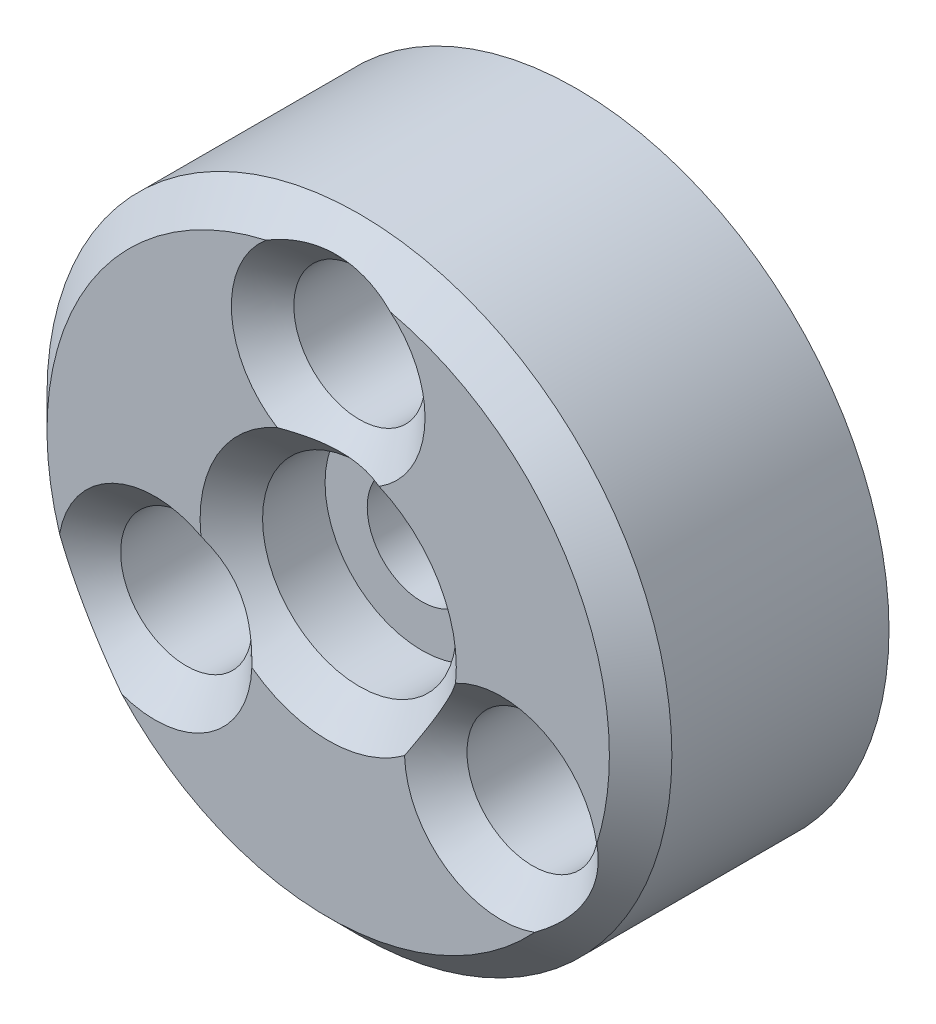
from build123d import *

# Parameters (mm, degrees)
SKETCH1_R                = 10
SKETCH1_R_2              = 2.1
SKETCH1_R_3              = 1.75
BOSS_EXTRUDE1_DEPTH      = 4
SKETCH2_R                = 9.05
CUT_EXTRUDE1_DEPTH       = 2.9
CHAMFER1_SIZE            = 1
BOSS_EXTRUDE2_DEPTH      = 2.9
BOSS_EXTRUDE2_DEPTH_BACK = 5.1
SKETCH3_R                = 2.1
CHAMFER2_SIZE            = 0.6
SKETCH4_R                = 3.1
CUT_EXTRUDE2_DEPTH       = 3
SKETCH5_R                = 2.1
CUT_EXTRUDE3_DEPTH       = 4
SKETCH6_R                = 0.625
CUT_EXTRUDE4_DEPTH       = 15.696938457
CIRPATTERN1_COUNT        = 3
CHAMFER3_SIZE            = 1
CHAMFER4_SIZE            = 1


with BuildPart() as part:
    # Sketch1 → Boss-Extrude1 (new, symmetric)
    with BuildSketch(Plane.XY):
        Circle(SKETCH1_R)
        with Locations((6, 0)):
            Circle(SKETCH1_R_2, mode=Mode.SUBTRACT)
        Circle(SKETCH1_R_3, mode=Mode.SUBTRACT)
        with Locations((0, -6)):
            Circle(SKETCH1_R_2, mode=Mode.SUBTRACT)
        with Locations((-6, 0)):
            Circle(SKETCH1_R_2, mode=Mode.SUBTRACT)
        with Locations((0, 6)):
            Circle(SKETCH1_R_2, mode=Mode.SUBTRACT)
    extrude(amount=BOSS_EXTRUDE1_DEPTH, both=True)

    # Sketch2 → Cut-Extrude1 (cut)
    with BuildSketch(Plane(origin=(0, 0, -4), x_dir=(-1, 0, 0), z_dir=(0, 0, -1))):
        Circle(SKETCH2_R)
    extrude(amount=-CUT_EXTRUDE1_DEPTH, mode=Mode.SUBTRACT)

    # Chamfer1
    # the kernel refuses this chamfer: 1 mm, written as the material it takes off along each edge
    with BuildSketch(Plane(origin=(0, 0, -4), x_dir=(-1, 0, 0), z_dir=(0, -1, 0))) as chamfer1_piece_1:
        Polygon((9.05 + CHAMFER1_SIZE, 0), (9.05, -CHAMFER1_SIZE), (9.05, 0), align=None)
    revolve(axis=Axis((0, 0, -4), (0, 0, -1)), mode=Mode.SUBTRACT)

    # Sketch3 → Boss-Extrude2 (add, two sides: drawn at the far end of the back side and taken through both)
    with BuildSketch(Plane(origin=(0, 0, -1.1), x_dir=(-1, 0, 0), z_dir=(0, 0, -1)).offset(-BOSS_EXTRUDE2_DEPTH_BACK)):
        with Locations((-6, 0)):
            Circle(SKETCH3_R)
        with Locations((0, -6)):
            Circle(SKETCH3_R)
        with Locations((6, 0)):
            Circle(SKETCH3_R)
        with Locations((0, 6)):
            Circle(SKETCH3_R)
    extrude(amount=BOSS_EXTRUDE2_DEPTH + BOSS_EXTRUDE2_DEPTH_BACK)

    # Chamfer2
    chamfer2_edges = [part.edges().sort_by_distance(p)[0] for p in [
        (8.1, 0, -4),
        (2.1, -6, -4),
        (-3.9, 0, -4),
        (2.1, 6, -4),
    ]]
    chamfer(chamfer2_edges, length=CHAMFER2_SIZE)

    # Sketch4 → Cut-Extrude2 (cut)
    with BuildSketch(Plane.XY.offset(4)):
        Circle(SKETCH4_R)
    extrude(amount=-CUT_EXTRUDE2_DEPTH, mode=Mode.SUBTRACT)

    # Sketch5 → Cut-Extrude3 (cut)
    with BuildSketch(Plane.XY.offset(4)):
        with Locations((0, 6.4)):
            Circle(SKETCH5_R)
        with Locations((5.542562584, -3.2)):
            Circle(SKETCH5_R)
        with Locations((-5.542562584, -3.2)):
            Circle(SKETCH5_R)
    extrude(amount=-CUT_EXTRUDE3_DEPTH, mode=Mode.SUBTRACT)

    # Sketch6 → Cut-Extrude4 (cut, through all)
    with BuildSketch(Plane.XY):
        with Locations((0, 6.4)):
            Circle(SKETCH6_R)
    cut_extrude4 = extrude(amount=-CUT_EXTRUDE4_DEPTH, mode=Mode.SUBTRACT)

    # CirPattern1: Cut-Extrude4 ×3 about axis
    cirpattern1_axis = Axis((0, 0, 0), (0, 0, 1))
    for i in range(1, CIRPATTERN1_COUNT):
        add(cut_extrude4.rotate(cirpattern1_axis, i * 360 / CIRPATTERN1_COUNT), mode=Mode.SUBTRACT)

    # Chamfer3
    chamfer3_edges = [part.edges().sort_by_distance(p)[0] for p in [
        (-0.625, 6.4, 0),
        (5.855062584, -2.658734123, 0),
        (-5.230062584, -3.741265877, 0),
    ]]
    chamfer(chamfer3_edges, length=CHAMFER3_SIZE)

    # Chamfer4
    # the kernel refuses this chamfer: 1 mm, written as the material it takes off along each edge
    with BuildSketch(Plane(origin=(0, 6.4, 4), x_dir=(1, 0, 0), z_dir=(0, -1, 0))) as chamfer4_piece_1:
        Polygon((2.1 + CHAMFER4_SIZE, 0), (2.1, -CHAMFER4_SIZE), (2.1, 0), align=None)
    revolve(axis=Axis((0, 6.4, 4), (0, 0, 1)), mode=Mode.SUBTRACT)
    with BuildSketch(Plane(origin=(5.542562584, -3.2, 4), x_dir=(1, 0, 0), z_dir=(0, -1, 0))) as chamfer4_piece_2:
        Polygon((2.1, -CHAMFER4_SIZE), (2.1 + CHAMFER4_SIZE, 0), (2.1, 0), align=None)
    revolve(axis=Axis((5.542562584, -3.2, 4), (0, 0, 1)), mode=Mode.SUBTRACT)
    with BuildSketch(Plane(origin=(-5.542562584, -3.2, 4), x_dir=(1, 0, 0), z_dir=(0, -1, 0))) as chamfer4_piece_3:
        Polygon((2.1 + CHAMFER4_SIZE, 0), (2.1, -CHAMFER4_SIZE), (2.1, 0), align=None)
    revolve(axis=Axis((-5.542562584, -3.2, 4), (0, 0, 1)), mode=Mode.SUBTRACT)
    with BuildSketch(Plane(origin=(0, 0, 4), x_dir=(1, 0, 0), z_dir=(0, -1, 0))) as chamfer4_piece_4:
        Polygon((10 - CHAMFER4_SIZE, 0), (10, -CHAMFER4_SIZE), (10, 0), align=None)
    revolve(axis=Axis((0, 0, 4), (0, 0, 1)), mode=Mode.SUBTRACT)
    with BuildSketch(Plane(origin=(0, 0, 4), x_dir=(1, 0, 0), z_dir=(0, -1, 0))) as chamfer4_piece_5:
        Polygon((3.1 + CHAMFER4_SIZE, 0), (3.1, -CHAMFER4_SIZE), (3.1, 0), align=None)
    revolve(axis=Axis((0, 0, 4), (0, 0, 1)), mode=Mode.SUBTRACT)


solid = part.part
